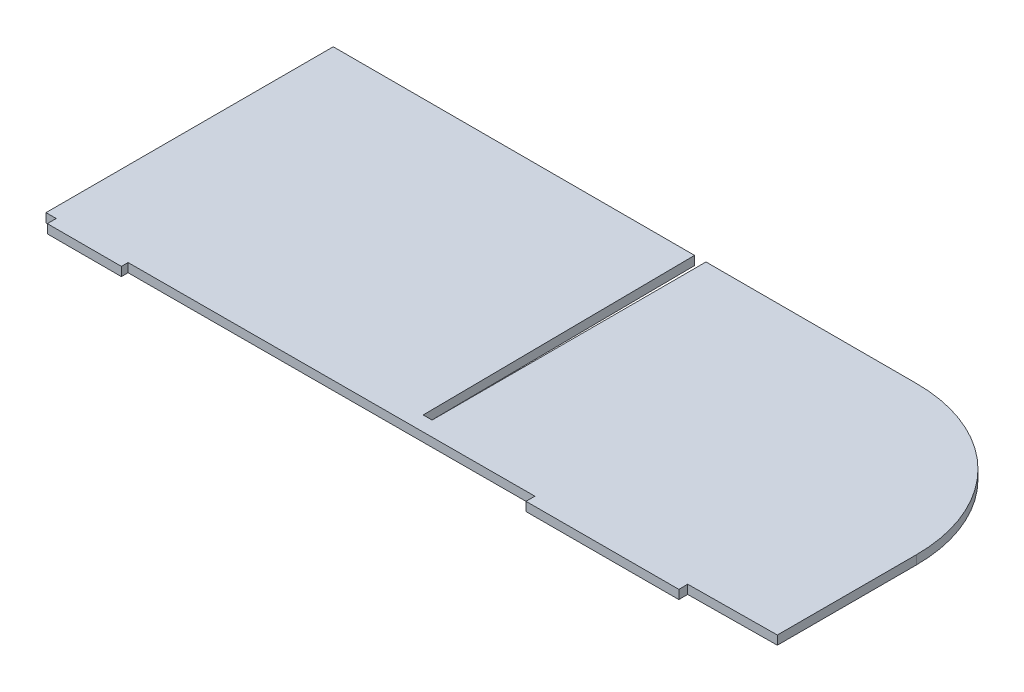
from build123d import *

# Parameters (mm, degrees)
BOSS_EXTRUDE1_DEPTH = 6


with BuildPart() as part:
    # Sketch1 → Boss-Extrude1 (new body)
    with BuildSketch(Plane(origin=(0, 0, 0), x_dir=(1, 0, 0), z_dir=(0, 1, 0))):
        with BuildLine():
            Line((-230.939328805, 359.613336513), (13.060671195, 359.613336513))
            Line((13.060671195, 359.613336513), (14.772876028, 174.617381496))
            Line((14.772876028, 174.617381496), (20.77285678, 174.632579043))
            Line((20.77285678, 174.632579043), (20.77285678, 359.613336513))
            Line((20.77285678, 359.613336513), (163.060671195, 359.613336513))
            ThreePointArc((163.060671195, 359.613336513), (233.771349313, 330.324014632), (263.060671195, 259.613336513))
            Line((263.060671195, 259.613336513), (263.060671195, 165.525355473))
            Line((263.060671195, 165.525355473), (203.060671195, 164.959623161))
            Line((203.060671195, 164.959623161), (203.117241911, 158.959889854))
            Line((203.117241911, 158.959889854), (100.015357446, 158.833243631))
            Line((100.015357446, 158.833243631), (100.000159899, 164.833224383))
            Line((100.000159899, 164.833224383), (-174.041373664, 164.139095649))
            Line((-174.041373664, 164.139095649), (-174.041373664, 159.613336513))
            Line((-174.041373664, 159.613336513), (-224.041373664, 159.613336513))
            Line((-224.041373664, 159.613336513), (-224.041373664, 165.613336513))
            Line((-224.041373664, 165.613336513), (-230.939328805, 165.613336513))
            Line((-230.939328805, 165.613336513), (-230.939328805, 359.613336513))
        make_face()
    extrude(amount=BOSS_EXTRUDE1_DEPTH)


solid = part.part
